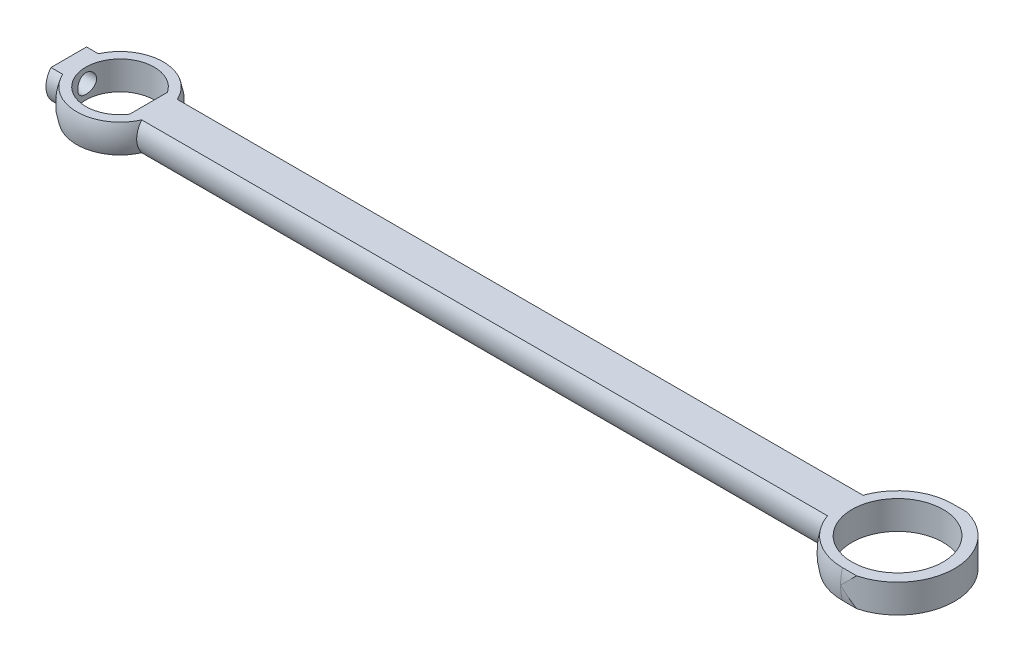
from build123d import *

# Parameters (mm, degrees)
EXTRUDE_1_DEPTH          = 100
CUT_EXTRUDE_START        = -2.5
CUT_EXTRUDE_1_OUTLINE_W  = 107.411770938
CUT_EXTRUDE_1_OUTLINE_H  = 17.637554046
CUT_EXTRUDE_1_OUTLINE_R  = 4
CUT_EXTRUDE_1_DEPTH      = 2.5
CUT_EXTRUDE_2_DEPTH      = 100
CUT_EXTRUDE_2_DEPTH_BACK = 100
SKETCH_6_W               = 1
SKETCH_6_H               = 5
M2X0_35_1_D              = 1.65
M2X0_35_1_DEPTH          = 2
M2X0_35_1_TIP            = 0.495710011


# Read off the part's stored shape, not the designer's step: 切除-拉伸1
with BuildPart() as part:
    # 草图1 → 凸台-拉伸1 (new body)
    with BuildSketch(Plane(origin=(0, 0, 0), x_dir=(0, 0, -1), z_dir=(1, 0, 0))):
        with BuildLine():
            Line((4.841229183, 1.25), (0, 1.25))
            Line((0, 1.25), (0, -1.25))
            Line((0, -1.25), (4.841229183, -1.25))
            ThreePointArc((4.841229183, -1.25), (4.960148481, -0.630021462), (5, 0))
            ThreePointArc((5, 0), (4.960148481, 0.630021462), (4.841229183, 1.25))
        make_face()
        with BuildLine():
            Line((0, -1.25), (0, 1.25))
            Line((0, 1.25), (-4.841229183, 1.25))
            ThreePointArc((-4.841229183, 1.25), (-5, 0), (-4.841229183, -1.25))
            Line((-4.841229183, -1.25), (0, -1.25))
        make_face()
    extrude(amount=EXTRUDE_1_DEPTH)

    # 切除-拉伸1 outline → 切除-拉伸1 (cut)
    # profile 1 of 3: a face of its own
    with BuildSketch(Plane(origin=(0, 1.25, 0), x_dir=(1, 0, 0), z_dir=(0, 1, 0)).offset(CUT_EXTRUDE_START)):
        with Locations((50.551661955, -0.114939413)):
            Rectangle(CUT_EXTRUDE_1_OUTLINE_W, CUT_EXTRUDE_1_OUTLINE_H)
        with BuildLine():
            Line((15.8786768, 5), (84.1213232, 5))
            ThreePointArc((84.1213232, 5), (89.1213232, 0), (84.1213232, -5))
            Line((84.1213232, -5), (15.8786768, -5))
            ThreePointArc((15.8786768, -5), (10.8786768, 0), (15.8786768, 5))
        make_face(mode=Mode.SUBTRACT)
    # profile 2 of 3: a face of its own
    with BuildSketch(Plane(origin=(0, 1.25, 0), x_dir=(1, 0, 0), z_dir=(0, 1, 0)).offset(CUT_EXTRUDE_START)):
        with BuildLine():
            Line((18.3786768, -1.658312395), (18.3786768, 1.658312395))
            ThreePointArc((18.3786768, 1.658312395), (12.8786768, 0), (18.3786768, -1.658312395))
        make_face()
    # profile 3 of 3: a face of its own
    with BuildSketch(Plane(origin=(0, 1.25, 0), x_dir=(1, 0, 0), z_dir=(0, 1, 0)).offset(CUT_EXTRUDE_START)):
        with Locations((84.1213232, 0)):
            Circle(CUT_EXTRUDE_1_OUTLINE_R)
    extrude(amount=CUT_EXTRUDE_1_DEPTH, mode=Mode.SUBTRACT)

    # 草图3 → 切除-旋转2 (revolve, cut)
    with BuildSketch(Plane(origin=(0, 0, 0), x_dir=(1, 0, 0), z_dir=(0, 1, 0))):
        with BuildLine():
            Line((12.414575185, -2), (10.590757267, -2))
            Line((10.590757267, -2), (10.590757267, -5))
            Line((10.590757267, -5), (84.1213232, -5))
            ThreePointArc((84.1213232, -5), (81.382710412, -4.183300133), (79.538747505, -2))
            Line((79.538747505, -2), (19.342778415, -2))
            ThreePointArc((19.342778415, -2), (15.8786768, -4), (12.414575185, -2))
        make_face()
        with BuildLine():
            Line((10.590757267, 5), (10.590757267, 2))
            Line((10.590757267, 2), (12.414575185, 2))
            ThreePointArc((12.414575185, 2), (15.8786768, 4), (19.342778415, 2))
            Line((19.342778415, 2), (79.538747505, 2))
            ThreePointArc((79.538747505, 2), (81.382710412, 4.183300133), (84.1213232, 5))
            Line((84.1213232, 5), (10.590757267, 5))
        make_face()
    revolve(axis=Axis((10.590757267, 0, 0), (1, 0, 0)), mode=Mode.SUBTRACT)

    # 草图6 → 切除-拉伸2 (cut, two sides: drawn at the far end of the back side and taken through both)
    with BuildSketch(Plane(origin=(0, 0, 0), x_dir=(1, 0, 0), z_dir=(0, 1, 0)).offset(-CUT_EXTRUDE_2_DEPTH_BACK)):
        with Locations((10.8786768, 0)):
            Rectangle(SKETCH_6_W, SKETCH_6_H)
    extrude(amount=CUT_EXTRUDE_2_DEPTH + CUT_EXTRUDE_2_DEPTH_BACK, mode=Mode.SUBTRACT)

    # M2X0.35 螺纹孔的螺纹孔钻头1
    with Locations(Plane.ZY.offset(-11.3786768)):
        with Locations((0, 0)):
            Hole(M2X0_35_1_D / 2, depth=M2X0_35_1_DEPTH)
            with Locations((0, 0, -(M2X0_35_1_DEPTH + M2X0_35_1_TIP / 2))):  # 118° drill point
                Cone(0, M2X0_35_1_D / 2, M2X0_35_1_TIP, mode=Mode.SUBTRACT)


solid = part.part
